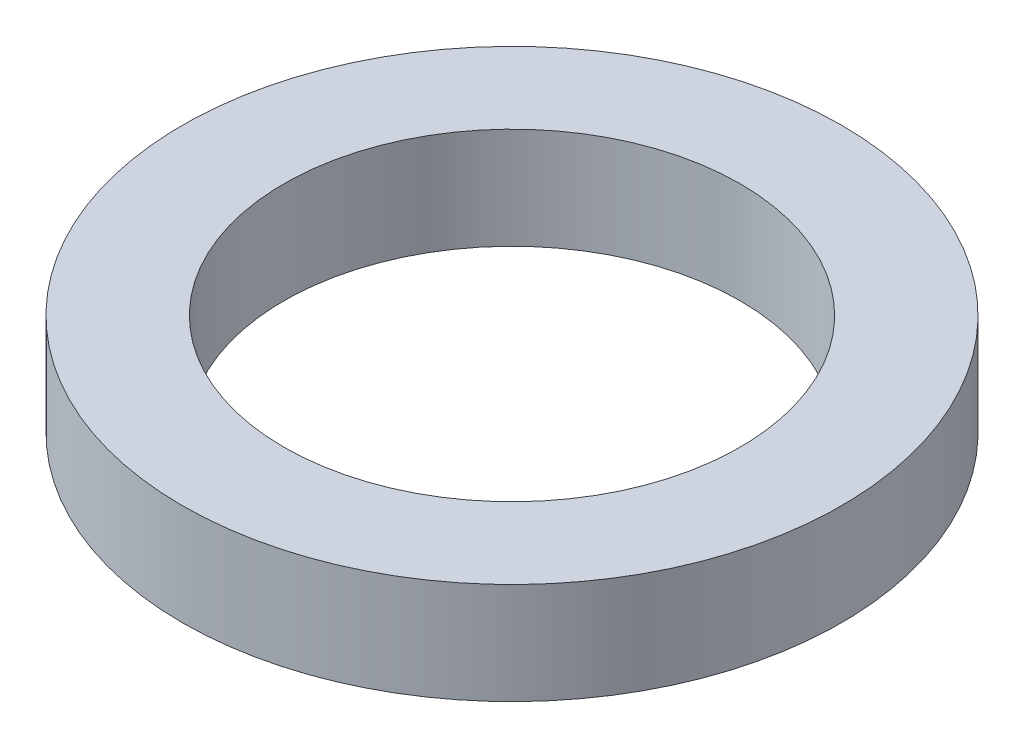
from build123d import *

# Parameters (mm, degrees)
SKETCH1_R           = 3.25
SKETCH1_R_2         = 2.25
BOSS_EXTRUDE1_DEPTH = 1


with BuildPart() as part:
    # Sketch1 → Boss-Extrude1 (new body)
    with BuildSketch(Plane(origin=(0, 0, 0), x_dir=(1, 0, 0), z_dir=(0, 1, 0))):
        Circle(SKETCH1_R)
        Circle(SKETCH1_R_2, mode=Mode.SUBTRACT)
    extrude(amount=BOSS_EXTRUDE1_DEPTH)


solid = part.part
